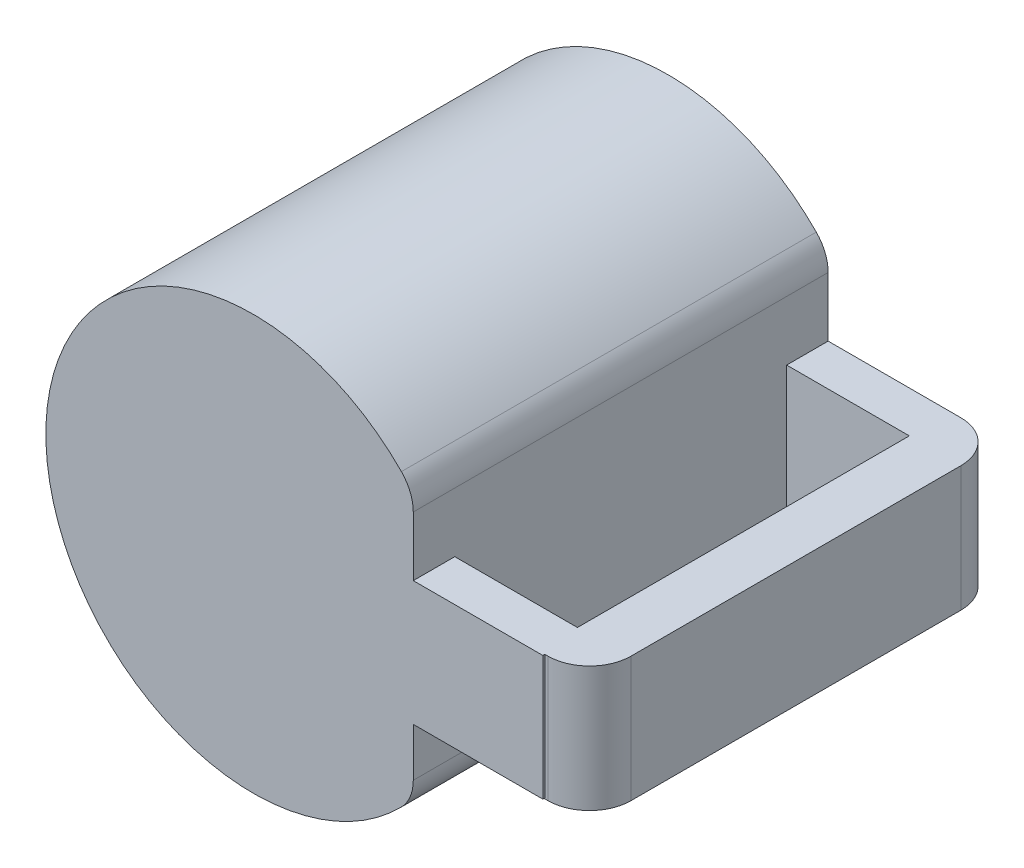
from build123d import *

# Parameters (mm, degrees)
SKETCH_1_R            = 5
EXTRUDE_1_DEPTH       = 10
SKETCH_9_W            = 7.120641766
SKETCH_9_H            = 4.534999238
EXTRUDE_6_DEPTH       = 1
SKETCH_11_W           = 1.257653538
SKETCH_11_H           = 9
EXTRUDE_7_DEPTH       = 4.5
EXTRUDE_8_DEPTH       = 6
FILLET_8_R            = 1
FILLET_9_R            = 1
CUT_EXTRUDE_1_DEPTH   = 10
SKETCH_14_W           = 1
SKETCH_14_H           = 3
EXTRUDE_9_DEPTH       = 3.122043073
SKETCH_15_W           = 1
SKETCH_15_H           = 3
EXTRUDE_10_DEPTH      = 4
EXTRUDE_11_DEPTH      = 0.2
EXTRUDE_11_DEPTH_BACK = 1.043632387
SKETCH_16_W           = 9.952294967
SKETCH_16_H           = 3.01746433
FILLET_11_R           = 1
FILLET_12_R           = 1
FILLET_13_R           = 1
FILLET_14_R           = 1


with BuildPart() as part:
    # 草圖1 → 填料-伸長1 (new body)
    with BuildSketch(Plane(origin=(0.382706605, 0, 0), x_dir=(1, 0, 0), z_dir=(0, 0, 1))):
        with Locations((-75.594417438, 2.55)):
            Circle(SKETCH_1_R)
    extrude(amount=EXTRUDE_1_DEPTH)

    # 草圖9 → 填料-伸長6 (add)
    with BuildSketch(Plane(origin=(6.127831546, 0, 9), x_dir=(1, 0, 0), z_dir=(0, 0, 1))):
        with Locations((-75.644850643, 2.267499619)):
            Rectangle(SKETCH_9_W, SKETCH_9_H)
    extrude(amount=EXTRUDE_6_DEPTH)



with BuildPart() as body_2:
    # 草圖11 → 填料-伸長7 (new body)
    with BuildSketch(Plane(origin=(9.574526933, 4.534999238, 0.48426017), x_dir=(1, 0, 0), z_dir=(0, 1, 0))):
        with Locations((-76.184774061, -4.5)):
            Rectangle(SKETCH_11_W, SKETCH_11_H)
    extrude(amount=-EXTRUDE_7_DEPTH)


with BuildPart() as part_1:
    add(part.part)

    add(body_2.part)  # 填料-伸長8 merges body 2
    # 草圖12 → 填料-伸長8 (add)
    with BuildSketch(Plane.ZY.offset(67.239073897)):
        Polygon((0.48426017, 4.534999238), (0.48426017, 0), (1.483647509, 0.034999238), (1.483647509, 4.534999238), align=None)
    extrude(amount=EXTRUDE_8_DEPTH)

    # 圓角8
    fillet_8_edges = [part_1.edges().sort_by_distance(p)[0] for p in [
        (-65.981420359, 2.284999238, 0.48426017),
    ]]
    fillet(fillet_8_edges, radius=FILLET_8_R)

    # 圓角9
    fillet_9_edges = [part_1.edges().sort_by_distance(p)[0] for p in [
        (-65.956698214, 2.267499619, 10),
    ]]
    fillet(fillet_9_edges, radius=FILLET_9_R - 0.0001)  # a hair under: the kernel refuses the full size

    # 草圖13 → 除料-伸長1 (cut)
    with BuildSketch(Plane(origin=(0, 0, 0), x_dir=(-1, 0, 0), z_dir=(0, 0, -1))):
        with BuildLine():
            Line((71.355365605, 5.732546384), (71.355365605, -0.632546384))
            ThreePointArc((71.355365605, -0.632546384), (70.211710833, 2.55), (71.355365605, 5.732546384))
        make_face()
    extrude(amount=-CUT_EXTRUDE_1_DEPTH, mode=Mode.SUBTRACT)


with BuildPart() as body_2_2:
    # of the pieces the cut leaves, the one that is kept (cut_extrude_1_keep)
    add(part_1.part.solids().sort_by_distance((-71.355365605, 5.732546384, 0))[0])

    # 草圖14 → 填料-伸長9 (add)
    with BuildSketch(Plane(origin=(-71.355365605, 0, 0), x_dir=(0, 0, -1), z_dir=(1, 0, 0))):
        with Locations((-9.5, 2.417510407)):
            Rectangle(SKETCH_14_W, SKETCH_14_H)
    extrude(amount=EXTRUDE_9_DEPTH)

    # 草圖15 → 填料-伸長10 (add)
    with BuildSketch(Plane(origin=(-71.355365605, 0, 0), x_dir=(0, 0, -1), z_dir=(1, 0, 0))):
        with Locations((-0.5, 2.417510407)):
            Rectangle(SKETCH_15_W, SKETCH_15_H)
    extrude(amount=EXTRUDE_10_DEPTH)

    # 草圖16 → 填料-伸長11 (add, two sides: drawn at the far end of the back side and taken through both)
    with BuildSketch(Plane(origin=(-67.355365605, 0, 0), x_dir=(0, 0, -1), z_dir=(1, 0, 0)).offset(-EXTRUDE_11_DEPTH_BACK)):
        with Locations((-4.976147484, 2.408778242)):
            Rectangle(SKETCH_16_W, SKETCH_16_H)
    extrude(amount=EXTRUDE_11_DEPTH + EXTRUDE_11_DEPTH_BACK)

    # 圓角11
    fillet_11_edges = [body_2_2.edges().sort_by_distance(p)[0] for p in [
        (-67.155365605, 2.408778242, 0),
    ]]
    fillet(fillet_11_edges, radius=FILLET_11_R)

    # 圓角12
    fillet_12_edges = [body_2_2.edges().sort_by_distance(p)[0] for p in [
        (-67.155365605, 2.408778242, 9.952294967),
    ]]
    fillet(fillet_12_edges, radius=FILLET_12_R)

    # 圓角13
    fillet_13_edges = [body_2_2.edges().sort_by_distance(p)[0] for p in [
        (-71.355365605, 5.732546384, 5),
    ]]
    fillet(fillet_13_edges, radius=FILLET_13_R)

    # 圓角14
    fillet_14_edges = [body_2_2.edges().sort_by_distance(p)[0] for p in [
        (-71.355365605, -0.632546384, 5),
    ]]
    fillet(fillet_14_edges, radius=FILLET_14_R)


solid = body_2_2.part
